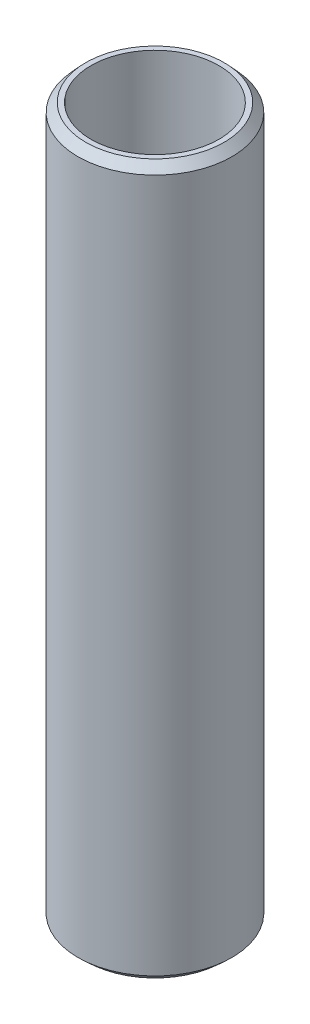
from build123d import *
from OCP.BRepFilletAPI import BRepFilletAPI_MakeChamfer

# Parameters (mm, degrees)
SKETCH1_R           = 35
BOSS_EXTRUDE1_DEPTH = 322.770922308
SKETCH2_R           = 29.084626439
CUT_EXTRUDE1_DEPTH  = 327.544129158
CHAMFER1_SIZE       = 3.877913095
CHAMFER1_SIZE2      = 3.556879479


with BuildPart() as part:
    # Sketch1 → Boss-Extrude1 (new body)
    with BuildSketch(Plane(origin=(0, 0, 0), x_dir=(1, 0, 0), z_dir=(0, 1, 0))):
        Circle(SKETCH1_R)
    extrude(amount=BOSS_EXTRUDE1_DEPTH)

    # Sketch2 → Cut-Extrude1 (cut, through all)
    with BuildSketch(Plane(origin=(0, 0, 0), x_dir=(1, 0, 0), z_dir=(0, 1, 0))):
        Circle(SKETCH2_R)
    extrude(amount=CUT_EXTRUDE1_DEPTH, mode=Mode.SUBTRACT)

    # Chamfer1: one chamfer whose edges measure the first distance from different faces: ONE call of the kernel's chamfer builder (chamfer() names one face for all edges)
    chamfer1_edges_1 = [part.edges().sort_by_distance(p)[0] for p in [
        (-35, 322.770922308, 0),
    ]]
    chamfer1_side_1 = [part.faces().sort_by_distance(p)[0] for p in [
        (-35, 161.385461154, 0),
    ]]
    chamfer1_edges_2 = [part.edges().sort_by_distance(p)[0] for p in [
        (-35, 0, 0),
    ]]
    chamfer1_side_2 = [part.faces().sort_by_distance(p)[0] for p in [
        (-34.010050506, 0, 0),
    ]]
    chamfer1 = BRepFilletAPI_MakeChamfer(part.part.solid().wrapped)
    for e in chamfer1_edges_1:
        chamfer1.Add(CHAMFER1_SIZE, CHAMFER1_SIZE2, e.wrapped, chamfer1_side_1[0].wrapped)  # the first distance lies on this face
    for e in chamfer1_edges_2:
        chamfer1.Add(CHAMFER1_SIZE, CHAMFER1_SIZE2, e.wrapped, chamfer1_side_2[0].wrapped)  # the first distance lies on this face
    add(Compound.cast(chamfer1.Shape()), mode=Mode.REPLACE)


solid = part.part
